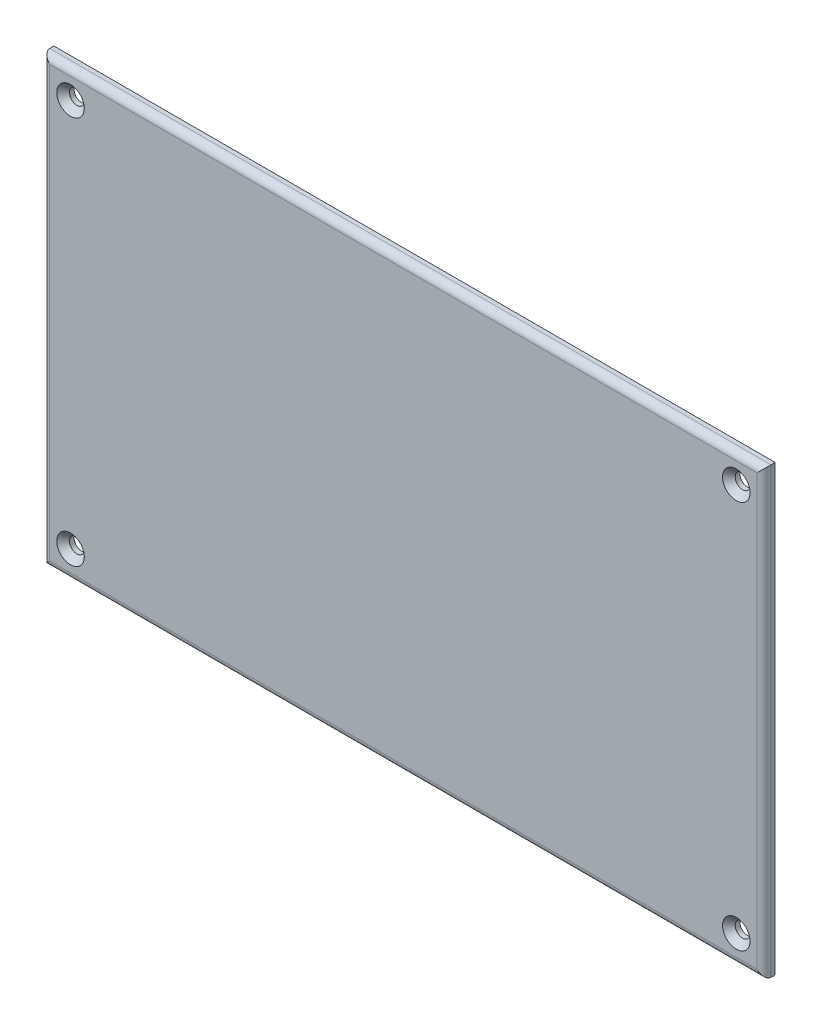
from build123d import *

# Parameters (mm, degrees)
SKETCH1_W                                       = 165.1
SKETCH1_H                                       = 101.6
BOSS_EXTRUDE1_DEPTH                             = 2.54
FILLET1_R                                       = 1.5875
CSK_FOR_M3_FLAT_HEAD_MACHINE_SCREW1_D           = 3.4
CSK_FOR_M3_FLAT_HEAD_MACHINE_SCREW1_DEPTH       = 6.35
CSK_FOR_M3_FLAT_HEAD_MACHINE_SCREW1_CSINK_D     = 6.3
CSK_FOR_M3_FLAT_HEAD_MACHINE_SCREW1_CSINK_ANGLE = 90
CSK_FOR_M3_FLAT_HEAD_MACHINE_SCREW1_TIP         = 1.021463052


with BuildPart() as part:
    # Sketch1 → Boss-Extrude1 (new body)
    with BuildSketch(Plane.XY):
        with Locations((82.55, 50.8)):
            Rectangle(SKETCH1_W, SKETCH1_H)
    extrude(amount=BOSS_EXTRUDE1_DEPTH)

    # Fillet1
    fillet1_edges = [part.edges().sort_by_distance(p)[0] for p in [
        (82.55, 101.6, 2.54),
        (165.1, 50.8, 2.54),
        (82.55, 0, 2.54),
        (0, 50.8, 2.54),
    ]]
    fillet(fillet1_edges, radius=FILLET1_R)

    # CSK for M3 Flat Head Machine Screw1
    with Locations(Plane.XY.offset(2.54)):
        with Locations((6.35, 95.25), (6.35, 6.35), (158.75, 6.35), (158.75, 95.25)):
            CounterSinkHole(CSK_FOR_M3_FLAT_HEAD_MACHINE_SCREW1_D / 2, CSK_FOR_M3_FLAT_HEAD_MACHINE_SCREW1_CSINK_D / 2, depth=CSK_FOR_M3_FLAT_HEAD_MACHINE_SCREW1_DEPTH, counter_sink_angle=CSK_FOR_M3_FLAT_HEAD_MACHINE_SCREW1_CSINK_ANGLE)
            with Locations((0, 0, -(CSK_FOR_M3_FLAT_HEAD_MACHINE_SCREW1_DEPTH + CSK_FOR_M3_FLAT_HEAD_MACHINE_SCREW1_TIP / 2))):  # 118° drill point
                Cone(0, CSK_FOR_M3_FLAT_HEAD_MACHINE_SCREW1_D / 2, CSK_FOR_M3_FLAT_HEAD_MACHINE_SCREW1_TIP, mode=Mode.SUBTRACT)


solid = part.part
